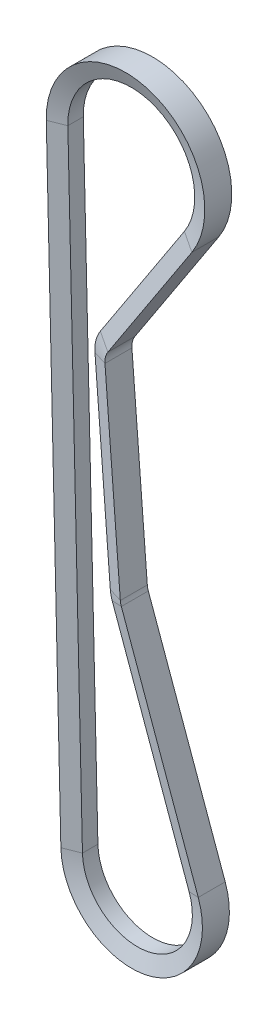
from build123d import *


with BuildPart() as part:
    # Sweep1: sweep along a path in Sketch2
    with BuildLine(Plane.XY) as sweep1_path:
        Line((-24.993140187, -0.585613847), (-30.146062876, 219.333569918))
        ThreePointArc((-30.146062876, 219.333569918), (5.530334366, 246.914444167), (21.27605104, 204.658292534))
        Line((21.27605104, 204.658292534), (-8.408452526, 159.29305808))
        ThreePointArc((-8.408452526, 159.29305808), (-9.246100655, 157.392666571), (-9.425779573, 155.323643188))
        Line((-9.425779573, 155.323643188), (-3.996362293, 85.534522059))
        ThreePointArc((-3.996362293, 85.534522059), (-3.873744361, 84.692842815), (-3.639739072, 83.875101639))
        Line((-3.639739072, 83.875101639), (23.520657689, 8.472228861))
        ThreePointArc((23.520657689, 8.472228861), (4.588374418, -24.575329503), (-24.993140187, -0.585613847))
    # Sketch3 → Sweep1 (sweep)
    with BuildSketch(Plane(origin=(23.520657689, 8.472228861, 0), x_dir=(-0.9408263075682078, -0.3388891544260039, 0), z_dir=(0.3388891544260039, -0.9408263075682078, 0))):
        Polygon((0, -4.7625), (0, 4.7625), (5.588, 2.728634331), (5.588, -2.728634331), align=None)
    sweep(path=sweep1_path.line)


solid = part.part
